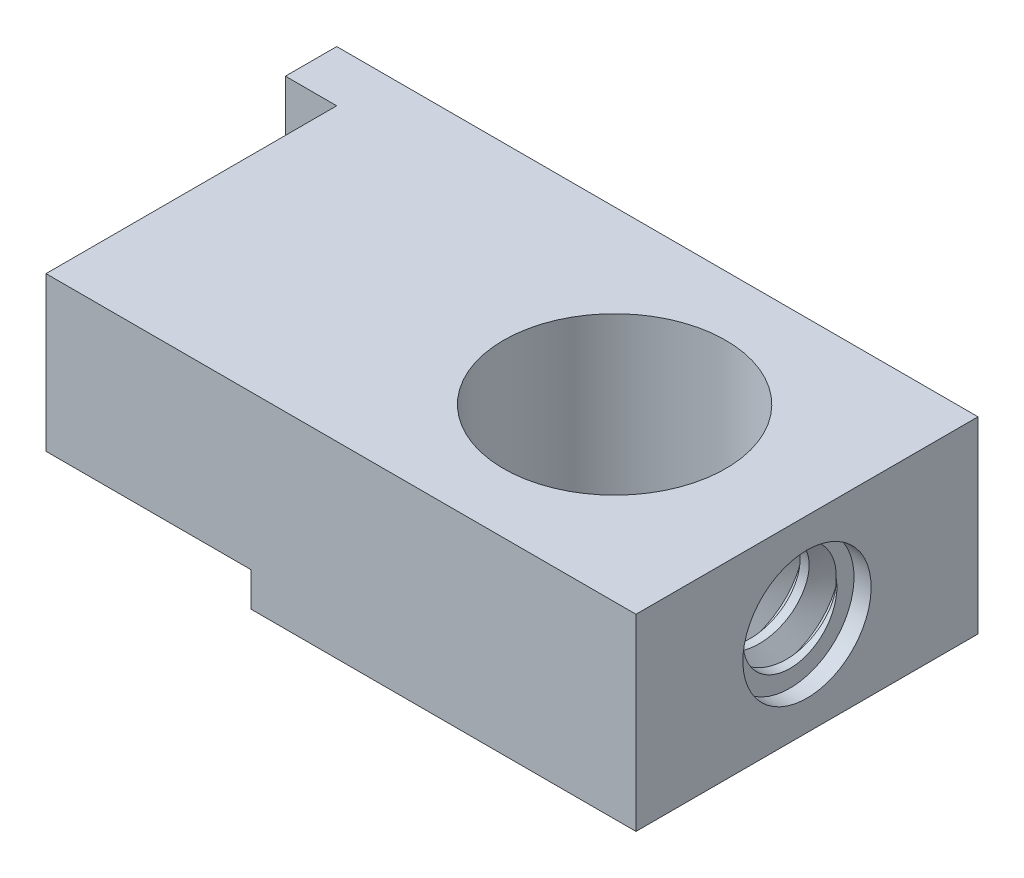
from build123d import *
from build123d.topology import SkipClean

# Parameters (mm, degrees)
SKETCH1_W               = 22.5
SKETCH1_H               = 11
BOSS_EXTRUDE1_DEPTH     = 20
SKETCH3_R               = 6.5
CUT_EXTRUDE1_DEPTH      = 26
SKETCH4_R               = 2.75
CUT_EXTRUDE2_DEPTH      = 9
SKETCH6_W               = 3
SKETCH6_H               = 11
BOSS_EXTRUDE4_DEPTH     = 15
THREAD1_PITCH           = 2.116666667
SKETCH7_W               = 17
SKETCH7_H               = 5
BOSS_EXTRUDE5_DEPTH     = 12
SKETCH8_W               = 12
SKETCH8_H               = 6.5
BOSS_EXTRUDE6_DEPTH     = 4
BOSS_EXTRUDE7_OUTLINE_W = 2.5
BOSS_EXTRUDE7_OUTLINE_H = 10.5
BOSS_EXTRUDE7_DEPTH     = 4
SKETCH11_R              = 3.75
CUT_EXTRUDE3_DEPTH      = 1


# Read off the part's stored shape, not the designer's step: Boss-Extrude7
with BuildPart() as part:
    # Sketch1 → Boss-Extrude1 (new body)
    with BuildSketch(Plane.XY):
        with Locations((-11.25, -5.5)):
            Rectangle(SKETCH1_W, SKETCH1_H)
    extrude(amount=BOSS_EXTRUDE1_DEPTH)

    # Sketch3 → Cut-Extrude1 (cut)
    with BuildSketch(Plane(origin=(0, 0, 0), x_dir=(1, 0, 0), z_dir=(0, 1, 0))):
        with Locations(Location((-11.25, -10, 0), (0, 0, 180))):
            Circle(SKETCH3_R)
    extrude(amount=-CUT_EXTRUDE1_DEPTH, mode=Mode.SUBTRACT)

    # Sketch4 → Cut-Extrude2 (cut)
    with BuildSketch(Plane(origin=(0, 0, 0), x_dir=(0, 0, -1), z_dir=(1, 0, 0))):
        with Locations(Location((-10, -5.5, 0), (0, 0, 90))):
            Circle(SKETCH4_R)
    extrude(amount=-CUT_EXTRUDE2_DEPTH, mode=Mode.SUBTRACT)

    # Sketch6 → Boss-Extrude4 (add)
    with BuildSketch(Plane.ZY.offset(22.5)):
        with Locations((1.5, -5.5)):
            Rectangle(SKETCH6_W, SKETCH6_H)
    extrude(amount=BOSS_EXTRUDE4_DEPTH)

    # Thread1: the profile of Thread Profile1 profile screwed along a right-hand helix of 6.614173 turns, 10 arcs to a turn; built about Z, then put on its axis
    with SkipClean():  # the faces are left unmerged after this step: merging them gives an invalid solid
        thread1_z = Axis((0, 0, 0), (0, 0, 1))
        thread1_corners = [(2.7497, 0, -0.000173205), (3.895679435, 0, 0.66145833), (3.895679435, 0, 0.926041664), (2.7497, 0, 1.587673199)]
        with BuildLine(mode=Mode.PRIVATE) as thread1_profile:
            Line(thread1_corners[0], thread1_corners[1])
            Line(thread1_corners[1], thread1_corners[2])
            Line(thread1_corners[2], thread1_corners[3])
            Line(thread1_corners[3], thread1_corners[0])
        thread1_cap = Face(thread1_profile.wire())
        thread1_turn_angles = [0, 18, 36, 54, 72, 90, 108, 126, 144, 162, 180, 198, 216, 234, 252, 270, 288, 306, 324, 342, 360]
        thread1_turn_weights = [1, 0.9510565162951535, 1, 0.9510565162951535, 1, 0.9510565162951535, 1, 0.9510565162951535, 1, 0.9510565162951535, 1, 0.9510565162951535, 1, 0.9510565162951535, 1, 0.9510565162951535, 1, 0.9510565162951535, 1, 0.9510565162951535, 1]
        thread1_turn_rails = [Edge.make_bspline([Vector(p[0], p[1], 0).rotate(thread1_z, thread1_turn_angles[k]) / thread1_turn_weights[k] + Vector(0, 0, p[2] + THREAD1_PITCH * thread1_turn_angles[k] / 360) for k in range(21)], [0, 0, 0, 1, 1, 2, 2, 3, 3, 4, 4, 5, 5, 6, 6, 7, 7, 8, 8, 9, 9, 10, 10, 10], 2, thread1_turn_weights) for p in thread1_corners]
        thread1_turn_sides = [Face.make_surface_from_curves(thread1_turn_rails[p[0]], thread1_turn_rails[p[1]]) for p in [(0, 1), (1, 2), (2, 3), (3, 0)]]
        thread1_last_angles = [2160, 2178, 2196, 2214, 2232, 2250, 2268, 2286, 2304, 2322, 2340, 2358, 2376, 2378.551181102, 2381.102362205]
        thread1_last_weights = [1, 0.9510565162951535, 1, 0.9510565162951535, 1, 0.9510565162951535, 1, 0.9510565162951535, 1, 0.9510565162951535, 1, 0.9510565162951535, 1, 0.9990088587214707, 1]
        thread1_last_rails = [Edge.make_bspline([Vector(p[0], p[1], 0).rotate(thread1_z, thread1_last_angles[k]) / thread1_last_weights[k] + Vector(0, 0, p[2] + THREAD1_PITCH * thread1_last_angles[k] / 360) for k in range(15)], [0, 0, 0, 1, 1, 2, 2, 3, 3, 4, 4, 5, 5, 6, 6, 7, 7, 7], 2, thread1_last_weights) for p in thread1_corners]
        thread1_last_sides = [Face.make_surface_from_curves(thread1_last_rails[p[0]], thread1_last_rails[p[1]]) for p in [(0, 1), (1, 2), (2, 3), (3, 0)]]
        thread1 = Plane(origin=(0, -5.5, 10), x_dir=(0, 0, 1), z_dir=(-1, 0, 0)) * Solid(Shell([*[p.moved(Location((0, 0, THREAD1_PITCH * i))) for i in range(6) for p in thread1_turn_sides], *thread1_last_sides, thread1_cap, thread1_cap.rotate(thread1_z, 2381.102362205).moved(Location((0, 0, THREAD1_PITCH * 2381.102362205 / 360)))]))
        add(thread1, mode=Mode.SUBTRACT)

    # Sketch7 → Boss-Extrude5 (add)
    with SkipClean():  # the faces are left unmerged after this step: merging them gives an invalid solid
        with BuildSketch(Plane.ZY.offset(22.5)):
            with Locations((11.5, -2.5)):
                Rectangle(SKETCH7_W, SKETCH7_H)
        extrude(amount=BOSS_EXTRUDE5_DEPTH)

    # Sketch8 → Boss-Extrude6 (add)
    with SkipClean():  # the faces are left unmerged after this step: merging them gives an invalid solid
        with BuildSketch(Plane(origin=(0, -5, 0), x_dir=(-1, 0, 0), z_dir=(0, -1, 0))):
            with Locations((28.5, -16.75)):
                Rectangle(SKETCH8_W, SKETCH8_H)
        extrude(amount=BOSS_EXTRUDE6_DEPTH)

    # Boss-Extrude7 outline → Boss-Extrude7 (add)
    with SkipClean():  # the faces are left unmerged after this step: merging them gives an invalid solid
        with BuildSketch(Plane(origin=(0, -5, 0), x_dir=(-1, 0, 0), z_dir=(0, -1, 0))):
            with Locations((33.25, -8.25)):
                Rectangle(BOSS_EXTRUDE7_OUTLINE_W, BOSS_EXTRUDE7_OUTLINE_H)
        extrude(amount=BOSS_EXTRUDE7_DEPTH)

    # Sketch11 → Cut-Extrude3 (cut)
    with BuildSketch(Plane(origin=(0, 0, 0), x_dir=(0, 0, -1), z_dir=(1, 0, 0))):
        with Locations(Location((-10, -5.5, 0), (0, 0, 90))):
            Circle(SKETCH11_R)
    extrude(amount=-CUT_EXTRUDE3_DEPTH, mode=Mode.SUBTRACT)


solid = part.part
